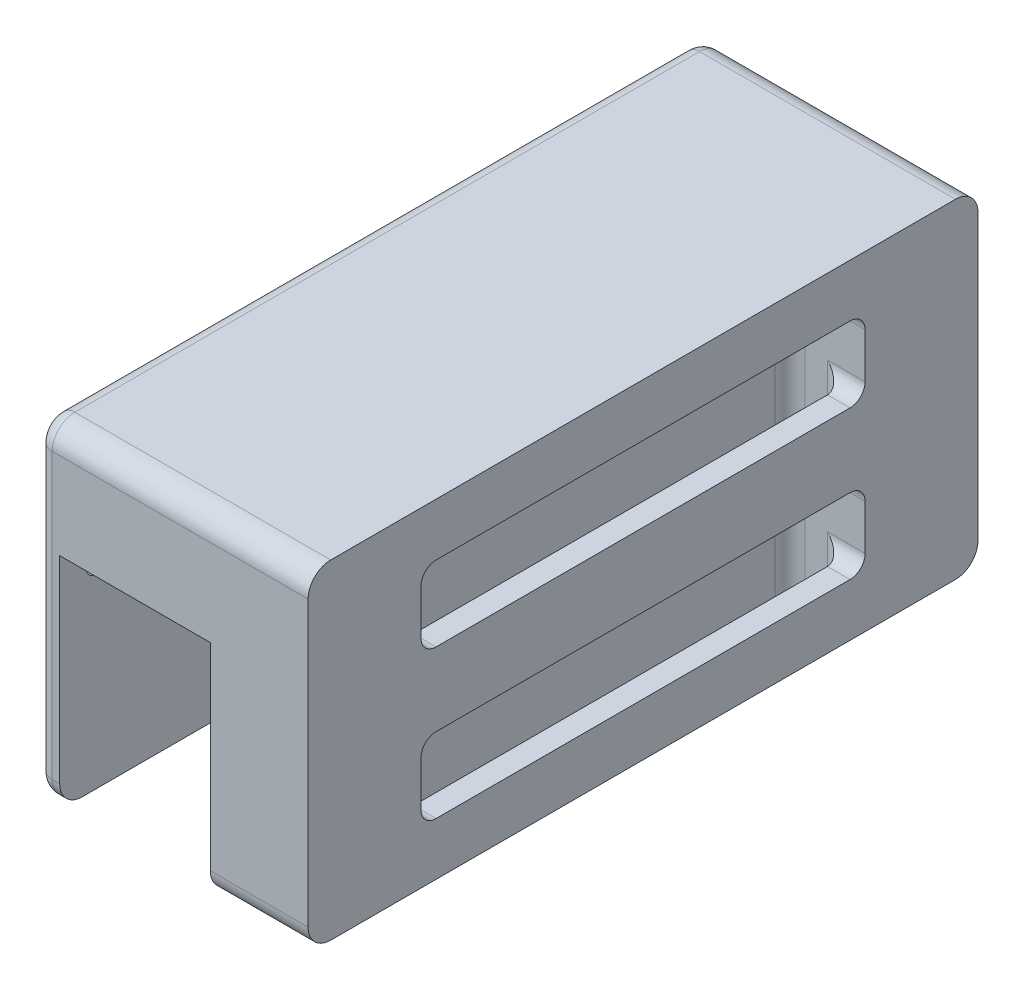
from build123d import *

# Parameters (mm, degrees)
RESSALTO_EXTRUS_O2_DEPTH      = 30
RESSALTO_EXTRUS_O3_START      = 3
RESSALTO_EXTRUS_O3_DEPTH      = 3
RESSALTO_EXTRUS_O4_DEPTH      = 3
RESSALTO_EXTRUS_O4_DEPTH_BACK = 10
CORTE_EXTRUS_O1_DEPTH         = 10
CORTE_EXTRUS_O2_REACH         = 83.702
FILETE1_START                 = -19.773073923
FILETE1_DEPTH                 = 36.75
FILETE1_START_2               = -13.40159992
FILETE1_2_DEPTH               = 59
ESBO_O10_R                    = 1.5
CORTE_EXTRUS_O3_DEPTH         = 10
CORTE_EXTRUS_O4_DEPTH         = 10
FILETE2_R                     = 2


with BuildPart() as part:
    # Esboço2 → Ressalto-extrusão2 (new body)
    with BuildSketch(Plane(origin=(0, 0, 0), x_dir=(0, 0, -1), z_dir=(1, 0, 0))):
        with BuildLine():
            Line((2.90159992, -0.062465938), (-35.09840008, -0.062465938))
            Line((-35.09840008, -0.062465938), (-39.886084903, -0.062465938))
            ThreePointArc((-39.886084903, -0.062465938), (-45.202180234, 1.467638524), (-48.891439328, 5.589707975))
            ThreePointArc((-48.891439328, 5.589707975), (-52.096536948, 9.772081499), (-56.69840008, 12.338743681))
            ThreePointArc((-56.69840008, 12.338743681), (-59.373224015, 11.895603401), (-60.59840008, 9.476926077))
            Line((-60.59840008, 9.476926077), (-60.59840008, 20.976926077))
            ThreePointArc((-60.59840008, 20.976926077), (-59.719720424, 23.09824642), (-57.59840008, 23.976926077))
            Line((-57.59840008, 23.976926077), (25.40159992, 23.976926077))
            ThreePointArc((25.40159992, 23.976926077), (27.522920263, 23.09824642), (28.40159992, 20.976926077))
            Line((28.40159992, 20.976926077), (28.40159992, 9.476926077))
            ThreePointArc((28.40159992, 9.476926077), (27.176423855, 11.895603401), (24.50159992, 12.338743681))
            ThreePointArc((24.50159992, 12.338743681), (19.899736788, 9.772081499), (16.694639168, 5.589707975))
            ThreePointArc((16.694639168, 5.589707975), (13.005380073, 1.467638524), (7.689284743, -0.062465938))
            Line((7.689284743, -0.062465938), (2.90159992, -0.062465938))
        make_face()
    extrude(amount=RESSALTO_EXTRUS_O2_DEPTH)

    # Esboço3 → Ressalto-extrusão3 (add)
    with BuildSketch(Plane.ZY.offset(RESSALTO_EXTRUS_O3_START)):
        with BuildLine():
            Line((60.59840008, 15.226926077), (60.59840008, 20.976926077))
            ThreePointArc((60.59840008, 20.976926077), (59.719720424, 23.09824642), (57.59840008, 23.976926077))
            Line((57.59840008, 23.976926077), (16.09840008, 23.976926077))
            Line((16.09840008, 23.976926077), (-25.40159992, 23.976926077))
            ThreePointArc((-25.40159992, 23.976926077), (-27.522920263, 23.09824642), (-28.40159992, 20.976926077))
            Line((-28.40159992, 20.976926077), (-28.40159992, 15.226926077))
            Line((-28.40159992, 15.226926077), (-28.40159992, -16.773073923))
            ThreePointArc((-28.40159992, -16.773073923), (-27.522920263, -18.894394267), (-25.40159992, -19.773073923))
            Line((-25.40159992, -19.773073923), (57.59840008, -19.773073923))
            ThreePointArc((57.59840008, -19.773073923), (59.719720424, -18.894394267), (60.59840008, -16.773073923))
            Line((60.59840008, -16.773073923), (60.59840008, 15.226926077))
        make_face()
    extrude(amount=-RESSALTO_EXTRUS_O3_DEPTH)

    # Esboço4 → Ressalto-extrusão4 (add, two sides: drawn at the far end of the back side and taken through both)
    with BuildSketch(Plane(origin=(30, 0, 0), x_dir=(0, 0, -1), z_dir=(1, 0, 0)).offset(-RESSALTO_EXTRUS_O4_DEPTH_BACK)):
        with BuildLine():
            Line((-16.09840008, 23.976926077), (25.40159992, 23.976926077))
            ThreePointArc((25.40159992, 23.976926077), (27.522920263, 23.09824642), (28.40159992, 20.976926077))
            Line((28.40159992, 20.976926077), (28.40159992, 15.226926077))
            Line((28.40159992, 15.226926077), (28.40159992, -16.773073923))
            ThreePointArc((28.40159992, -16.773073923), (27.522920263, -18.894394267), (25.40159992, -19.773073923))
            Line((25.40159992, -19.773073923), (-57.59840008, -19.773073923))
            ThreePointArc((-57.59840008, -19.773073923), (-59.719720424, -18.894394267), (-60.59840008, -16.773073923))
            Line((-60.59840008, -16.773073923), (-60.59840008, 15.226926077))
            Line((-60.59840008, 15.226926077), (-60.59840008, 20.976926077))
            ThreePointArc((-60.59840008, 20.976926077), (-59.719720424, 23.09824642), (-57.59840008, 23.976926077))
            Line((-57.59840008, 23.976926077), (-16.09840008, 23.976926077))
        make_face()
    extrude(amount=RESSALTO_EXTRUS_O4_DEPTH + RESSALTO_EXTRUS_O4_DEPTH_BACK)

    # Esboço8 → Corte-extrusão1 (cut)
    with BuildSketch(Plane(origin=(33, 0, 0), x_dir=(0, 0, -1), z_dir=(1, 0, 0))):
        with BuildLine():
            Line((-43.59840008, -2.773073923), (11.40159992, -2.773073923))
            ThreePointArc((11.40159992, -2.773073923), (12.815813482, -3.358860361), (13.40159992, -4.773073923))
            Line((13.40159992, -4.773073923), (13.40159992, -10.773073923))
            ThreePointArc((13.40159992, -10.773073923), (12.815813482, -12.187287486), (11.40159992, -12.773073923))
            Line((11.40159992, -12.773073923), (-43.59840008, -12.773073923))
            ThreePointArc((-43.59840008, -12.773073923), (-45.012613643, -12.187287486), (-45.59840008, -10.773073923))
            Line((-45.59840008, -10.773073923), (-45.59840008, -4.773073923))
            ThreePointArc((-45.59840008, -4.773073923), (-45.012613643, -3.358860361), (-43.59840008, -2.773073923))
        make_face()
        with BuildLine():
            Line((-43.59840008, 6.976926077), (11.40159992, 6.976926077))
            ThreePointArc((11.40159992, 6.976926077), (12.815813482, 7.562712514), (13.40159992, 8.976926077))
            Line((13.40159992, 8.976926077), (13.40159992, 14.976926077))
            ThreePointArc((13.40159992, 14.976926077), (12.815813482, 16.391139639), (11.40159992, 16.976926077))
            Line((11.40159992, 16.976926077), (-43.59840008, 16.976926077))
            ThreePointArc((-43.59840008, 16.976926077), (-45.012613643, 16.391139639), (-45.59840008, 14.976926077))
            Line((-45.59840008, 14.976926077), (-45.59840008, 8.976926077))
            ThreePointArc((-45.59840008, 8.976926077), (-45.012613643, 7.562712514), (-43.59840008, 6.976926077))
        make_face()
    extrude(amount=-CORTE_EXTRUS_O1_DEPTH, mode=Mode.SUBTRACT)

    # Corte-extrusão2: up to this face of the body (flat: up to its plane)
    corte_extrus_o2_end = Plane(part.part.faces().sort_by_distance((28, 16.976926077, 16.09840008))[0])
    # Esboço9 → Corte-extrusão2 (cut, up to the picked face)
    with BuildSketch(Plane(origin=(0, -19.773073923, 0), x_dir=(-1, 0, 0), z_dir=(0, -1, 0)), mode=Mode.PRIVATE) as corte_extrus_o2_sk1:
        with BuildLine():
            Line((-25, 13.40159992), (-28, 13.40159992))
            ThreePointArc((-28, 13.40159992), (-29.414213562, 12.815813482), (-30, 11.40159992))
            Line((-30, 11.40159992), (-30, -43.59840008))
            ThreePointArc((-30, -43.59840008), (-29.414213562, -45.012613643), (-28, -45.59840008))
            Line((-28, -45.59840008), (-25, -45.59840008))
            ThreePointArc((-25, -45.59840008), (-23.585786438, -45.012613643), (-23, -43.59840008))
            Line((-23, -43.59840008), (-23, 11.40159992))
            ThreePointArc((-23, 11.40159992), (-23.585786438, 12.815813482), (-25, 13.40159992))
        make_face()
    corte_extrus_o2_tool1 = split(extrude(corte_extrus_o2_sk1.sketch, amount=-CORTE_EXTRUS_O2_REACH, mode=Mode.PRIVATE), bisect_by=corte_extrus_o2_end, keep=Keep.BOTH, mode=Mode.PRIVATE)
    add(corte_extrus_o2_tool1.solids().sort_by(Axis((26.5, -19.773074, 16.0984), (0, 1, 0)))[0], mode=Mode.SUBTRACT)

    # Filete1: read off the stored shape, not the designer's step
    # Filete1 outline → Filete1 (add)
    with BuildSketch(Plane(origin=(0, 0, 0), x_dir=(1, 0, 0), z_dir=(0, 1, 0)).offset(FILETE1_START)):
        with BuildLine():
            ThreePointArc((25, -45.59840008), (23.585786437, -45.012613642), (23, -43.59840008))
            Line((23, -43.59840008), (23, -45.59840008))
            Line((23, -45.59840008), (25, -45.59840008))
        make_face()
        with BuildLine():
            ThreePointArc((23, 11.40159992), (23.585786438, 12.815813482), (25, 13.40159992))
            Line((25, 13.40159992), (23, 13.40159992))
            Line((23, 13.40159992), (23, 11.40159992))
        make_face()
    extrude(amount=FILETE1_DEPTH)

    # Filete1 2 outline → Filete1 2 (add)
    with BuildSketch(Plane.XY.offset(FILETE1_START_2)):
        with BuildLine():
            ThreePointArc((23, 14.976926077), (23.585786438, 16.391139639), (25, 16.976926077))
            Line((25, 16.976926077), (23, 16.976926077))
            Line((23, 16.976926077), (23, 14.976926077))
        make_face()
    extrude(amount=FILETE1_2_DEPTH)

    # Esboço10 → Corte-extrusão3 (cut)
    with BuildSketch(Plane(origin=(0, 0, 0), x_dir=(0, 0, -1), z_dir=(1, 0, 0))):
        with Locations((-55.59840008, 6.338743681)):
            Circle(ESBO_O10_R)
        with Locations((23.40159992, 6.338743681)):
            Circle(ESBO_O10_R)
        with Locations((-16.09840008, -8.562465938)):
            Circle(ESBO_O10_R)
    extrude(amount=-CORTE_EXTRUS_O3_DEPTH, mode=Mode.SUBTRACT)

    # Esboço12 → Corte-extrusão4 (cut)
    with BuildSketch(Plane(origin=(0, 0, 0), x_dir=(0, 0, -1), z_dir=(1, 0, 0))):
        with BuildLine():
            Line((-31.59840008, -2.862465938), (-25.59840008, -2.862465938))
            ThreePointArc((-25.59840008, -2.862465938), (-24.184186518, -3.448252375), (-23.59840008, -4.862465938))
            Line((-23.59840008, -4.862465938), (-23.59840008, -14.773073923))
            ThreePointArc((-23.59840008, -14.773073923), (-24.184186518, -16.187287486), (-25.59840008, -16.773073923))
            Line((-25.59840008, -16.773073923), (-31.59840008, -16.773073923))
            ThreePointArc((-31.59840008, -16.773073923), (-33.012613643, -16.187287486), (-33.59840008, -14.773073923))
            Line((-33.59840008, -14.773073923), (-33.59840008, -4.862465938))
            ThreePointArc((-33.59840008, -4.862465938), (-33.012613643, -3.448252375), (-31.59840008, -2.862465938))
        make_face()
        with BuildLine():
            Line((-6.59840008, -2.862465938), (-0.59840008, -2.862465938))
            ThreePointArc((-0.59840008, -2.862465938), (0.815813482, -3.448252375), (1.40159992, -4.862465938))
            Line((1.40159992, -4.862465938), (1.40159992, -14.773073923))
            ThreePointArc((1.40159992, -14.773073923), (0.815813482, -16.187287486), (-0.59840008, -16.773073923))
            Line((-0.59840008, -16.773073923), (-6.59840008, -16.773073923))
            ThreePointArc((-6.59840008, -16.773073923), (-8.012613643, -16.187287486), (-8.59840008, -14.773073923))
            Line((-8.59840008, -14.773073923), (-8.59840008, -4.862465938))
            ThreePointArc((-8.59840008, -4.862465938), (-8.012613643, -3.448252375), (-6.59840008, -2.862465938))
        make_face()
    extrude(amount=-CORTE_EXTRUS_O4_DEPTH, mode=Mode.SUBTRACT)

    # Filete2
    filete2_edges = [part.edges().sort_by_distance(p)[0] for p in [
        (-3, 2.101926077, 60.59840008),
        (-3, 23.09824642, 59.719720424),
        (-3, 23.976926077, 16.09840008),
        (-3, 23.09824642, -27.522920263),
        (-3, 2.101926077, -28.40159992),
        (-3, -18.894394267, -27.522920263),
        (-3, -19.773073923, 16.09840008),
        (-3, -18.894394267, 59.719720424),
    ]]
    fillet(filete2_edges, radius=FILETE2_R)


solid = part.part
